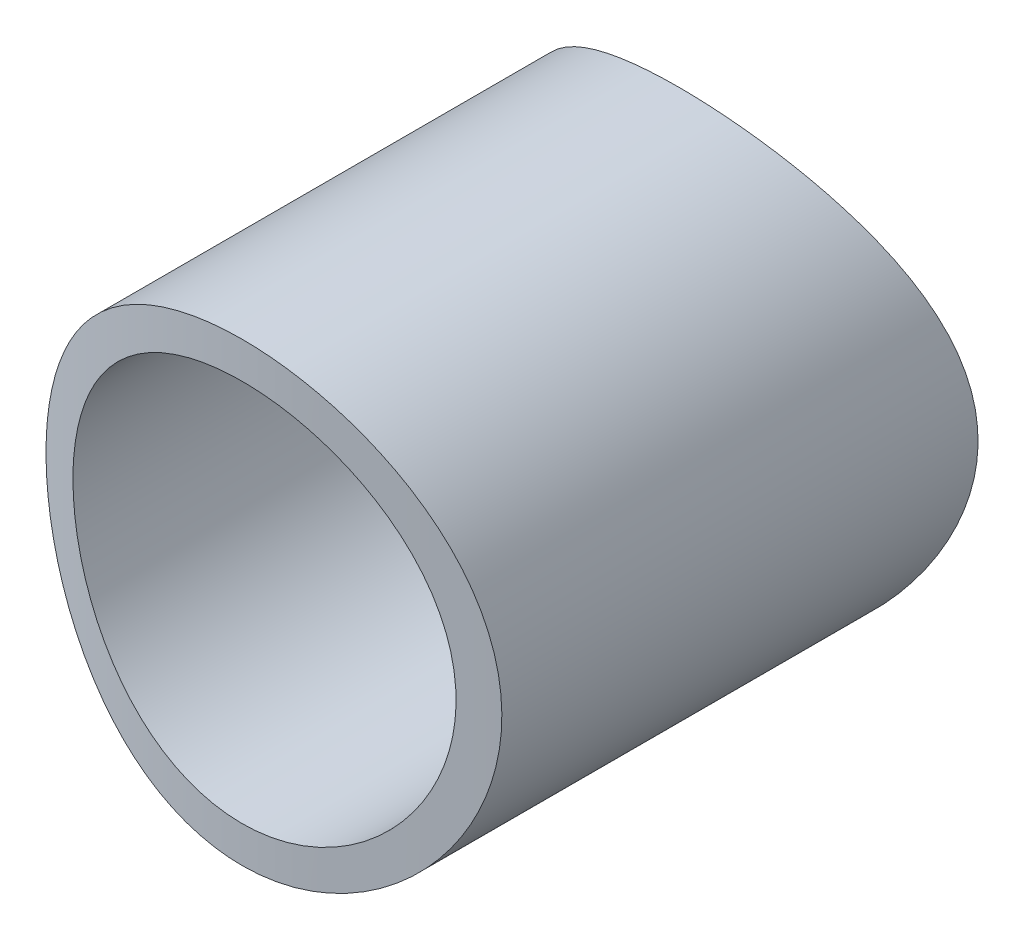
from build123d import *

# Parameters (mm, degrees)
SKETCH1_R               = 12.53
SKETCH1_R_2             = 10.53
BOSS_EXTRUDE1_DEPTH     = 60
CUT_EXTRUDE1_DEPTH      = 63.561983664
CUT_EXTRUDE1_DEPTH_BACK = 63.561983664
SKETCH2_R               = 74.589724577
SKETCH2_R_2             = 46
SKETCH2_R_3             = 22


with BuildPart() as part:
    # Sketch1 → Boss-Extrude1 (new body)
    with BuildSketch(Plane.XY):
        Circle(SKETCH1_R)
        Circle(SKETCH1_R_2, mode=Mode.SUBTRACT)
    extrude(amount=BOSS_EXTRUDE1_DEPTH)

    # Sketch2 → Cut-Extrude1 (cut, two sides: drawn at the far end of the back side and taken through both)
    # profile 1 of 2: a face of its own
    with BuildSketch(Plane(origin=(0, 0, 0), x_dir=(1, 0, 0), z_dir=(0, 1, 0)).offset(-CUT_EXTRUDE1_DEPTH_BACK)):
        Circle(SKETCH2_R)
        Circle(SKETCH2_R_2, mode=Mode.SUBTRACT)
    # profile 2 of 2: a face of its own
    with BuildSketch(Plane(origin=(0, 0, 0), x_dir=(1, 0, 0), z_dir=(0, 1, 0)).offset(-CUT_EXTRUDE1_DEPTH_BACK)):
        Circle(SKETCH2_R_3)
    extrude(amount=CUT_EXTRUDE1_DEPTH + CUT_EXTRUDE1_DEPTH_BACK, mode=Mode.SUBTRACT)


solid = part.part
